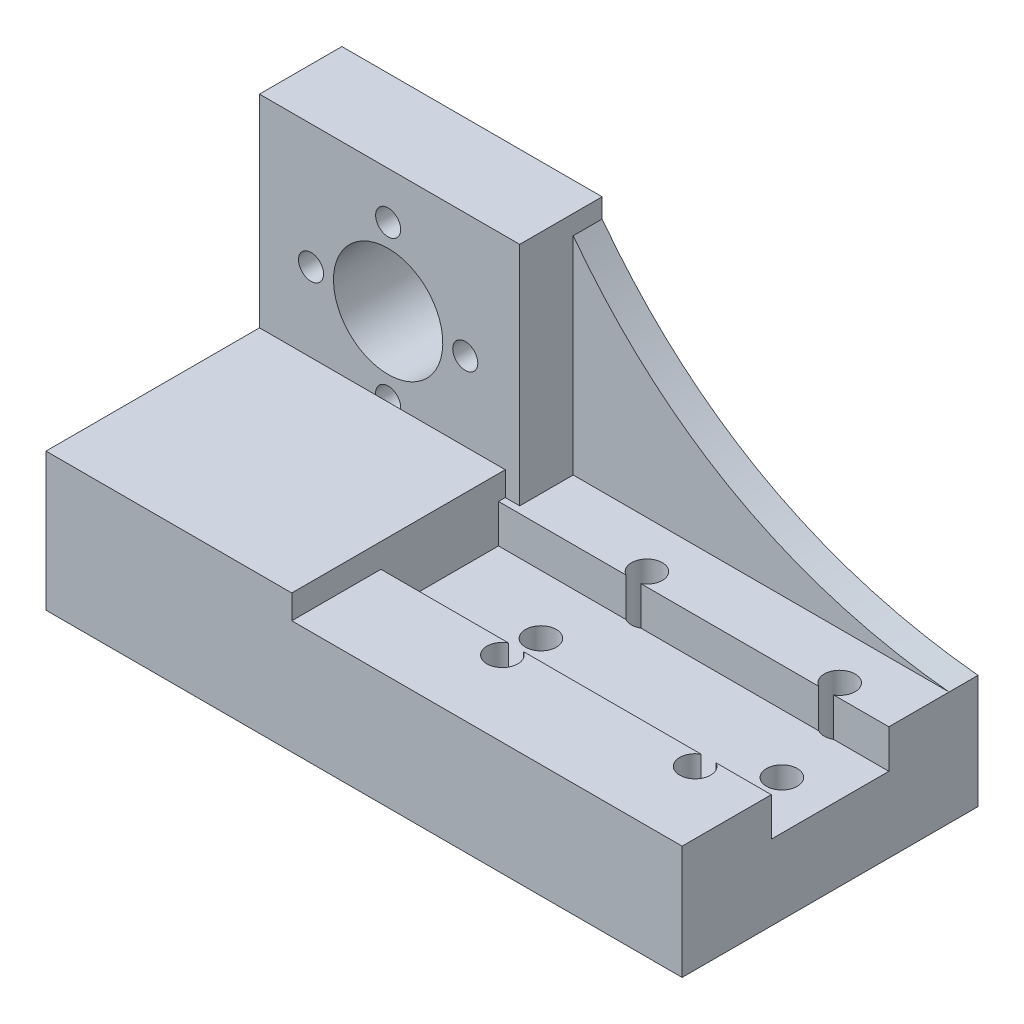
from build123d import *
from build123d.topology import SkipClean

# Parameters (mm, degrees)
CROQUIS2_R                         = 10.875
CROQUIS2_R_2                       = 5.67
CROQUIS2_R_3                       = 1.6
CROQUIS2_R_4                       = 1.3
SALIENTE_EXTRUIR1_DEPTH            = 30.7
CROQUIS4_W                         = 27
CROQUIS4_H                         = 26
CORTAR_EXTRUIR2_DEPTH              = 22.7
CROQUIS3_W                         = 12.3
CROQUIS3_H                         = 8
CORTAR_EXTRUIR5_DEPTH              = 45
CORTAR_EXTRUIR7_START              = -24.5
CROQUIS7_W                         = 48
CROQUIS7_H                         = 9.85
CORTAR_EXTRUIR7_DEPTH              = 24.5
CORTAR_EXTRUIR10_DEPTH             = 77.154202117
CORTAR_EXTRUIR10_DEPTH_BACK        = 77.154202117
CROQUIS11_R                        = 1.6
CROQUIS18_W                        = 48
CROQUIS18_H                        = 9.85
CORTAR_EXTRUIR12_DEPTH             = 8
CROQUIS19_W                        = 12.3
CROQUIS19_H                        = 8
CORTAR_EXTRUIR13_DEPTH             = 3
CROQUIS20_R                        = 1.3
CROQUIS20_R_2                      = 5.67
SALIENTE_EXTRUIR2_DEPTH            = 0.55
SALIENTE_EXTRUIR4_START            = -22.15
SALIENTE_EXTRUIR4_DEPTH            = 22.15
S_LIDO_MOVER_COPIAR1_START         = 8.55
S_LIDO_MOVER_COPIAR1_DEPTH         = 22.15
S_LIDO_MOVER_COPIAR1_2_DEPTH       = 22.15
S_LIDO_MOVER_COPIAR1_3_DEPTH       = 30.7
S_LIDO_MOVER_COPIAR1_4_OUTLINE_R   = 1.3
S_LIDO_MOVER_COPIAR1_4_OUTLINE_R_2 = 5.67
S_LIDO_MOVER_COPIAR1_4_DEPTH       = 8.55
S_LIDO_MOVER_COPIAR1_START_2       = -34.15
S_LIDO_MOVER_COPIAR1_5_OUTLINE_R   = 1.6
S_LIDO_MOVER_COPIAR1_5_OUTLINE_W   = 75
S_LIDO_MOVER_COPIAR1_5_OUTLINE_H   = 30.7
S_LIDO_MOVER_COPIAR1_5_DEPTH       = 52
CROQUIS23_R                        = 1.6
CORTAR_EXTRUIR17_DEPTH             = 144.777475635
CORTAR_EXTRUIR18_DEPTH             = 3
CORTAR_EXTRUIR18_DEPTH_BACK        = 144.777475635
CORTAR_EXTRUIR18_START             = -7.8
CROQUIS24_W                        = 75
CROQUIS24_H                        = 30.7
CORTAR_EXTRUIR19_DEPTH             = 11.7
CROQUIS28_W                        = 27
CROQUIS28_H                        = 8.55
CORTAR_EXTRUIR21_DEPTH             = 5
CORTAR_EXTRUIR22_START             = -8
CORTAR_EXTRUIR22_DEPTH             = 8
CROQUIS30_W                        = 1.5
CROQUIS30_H                        = 22.15
CORTAR_EXTRUIR23_DEPTH             = 6.5
CROQUIS31_W                        = 30.7
CROQUIS31_H                        = 7.8
CORTAR_EXTRUIR24_DEPTH             = 9
CROQUIS32_W                        = 40.5
CROQUIS32_H                        = 9.25
CROQUIS32_W_2                      = 39
SALIENTE_EXTRUIR5_DEPTH            = 4
CROQUIS33_W                        = 1.5
CROQUIS33_H                        = 0.7
SALIENTE_EXTRUIR6_DEPTH            = 4
CROQUIS34_R                        = 1.6
CORTAR_EXTRUIR25_DEPTH             = 143.013951779
SALIENTE_EXTRUIR7_DEPTH            = 3


with BuildPart() as part:
    # Croquis2 → Saliente-Extruir1 (new body)
    # profile 1 of 6: a face of its own
    with BuildSketch(Plane.XY):
        Polygon((-61.65, 17.85), (-61.65, -34.15), (-50.65, -34.15), (-50.65, -32.65), (-50.65, -22.65), (-50.65, -22.45), (-49.65, -22.45), (-22.65, -22.45), (-21.65, -22.45), (-21.65, -22.65), (-21.65, -32.65), (-21.65, -34.15), (13.35, -34.15), (13.35, 17.85), align=None)
        Circle(CROQUIS2_R, mode=Mode.SUBTRACT)
    # profile 2 of 6: a face of its own
    with BuildSketch(Plane.XY):
        Circle(CROQUIS2_R)
        with Locations(Location((0, 0, 0), (0, 0, 90))):
            Circle(CROQUIS2_R_2, mode=Mode.SUBTRACT)
        with Locations((0, -8)):
            Circle(CROQUIS2_R_3, mode=Mode.SUBTRACT)
        with Locations((-8, 0)):
            Circle(CROQUIS2_R_3, mode=Mode.SUBTRACT)
        with Locations((8, 0)):
            Circle(CROQUIS2_R_3, mode=Mode.SUBTRACT)
        with Locations((0, 8)):
            Circle(CROQUIS2_R_3, mode=Mode.SUBTRACT)
    # profile 3 of 6: a face of its own
    with BuildSketch(Plane.XY):
        with Locations((0, 8)):
            Circle(CROQUIS2_R_3)
        with Locations(Location((0, 8, 0), (0, 0, 90))):
            Circle(CROQUIS2_R_4, mode=Mode.SUBTRACT)
    # profile 4 of 6: a face of its own
    with BuildSketch(Plane.XY):
        with Locations((8, 0)):
            Circle(CROQUIS2_R_3)
        with Locations(Location((8, 0, 0), (0, 0, 90))):
            Circle(CROQUIS2_R_4, mode=Mode.SUBTRACT)
    # profile 5 of 6: a face of its own
    with BuildSketch(Plane.XY):
        with Locations((0, -8)):
            Circle(CROQUIS2_R_3)
        with Locations(Location((0, -8, 0), (0, 0, 90))):
            Circle(CROQUIS2_R_4, mode=Mode.SUBTRACT)
    # profile 6 of 6: a face of its own
    with BuildSketch(Plane.XY):
        with Locations((-8, 0)):
            Circle(CROQUIS2_R_3)
        with Locations(Location((-8, 0, 0), (0, 0, 90))):
            Circle(CROQUIS2_R_4, mode=Mode.SUBTRACT)
    extrude(amount=SALIENTE_EXTRUIR1_DEPTH)

    # Croquis4 → Cortar-Extruir2 (cut)
    with BuildSketch(Plane.XY.offset(30.7)):
        with Locations((-0.15, 4.85)):
            Rectangle(CROQUIS4_W, CROQUIS4_H)
    extrude(amount=-CORTAR_EXTRUIR2_DEPTH, mode=Mode.SUBTRACT)

    # Croquis3 → Cortar-Extruir5 (cut)
    with BuildSketch(Plane.ZY.offset(61.65)):
        with Locations((14.7, -10.65)):
            Rectangle(CROQUIS3_W, CROQUIS3_H)
    extrude(amount=-CORTAR_EXTRUIR5_DEPTH, mode=Mode.SUBTRACT)

    # Croquis7 → Cortar-Extruir7 (cut)
    with BuildSketch(Plane(origin=(0, 17.85, 0), x_dir=(1, 0, 0), z_dir=(0, 1, 0)).offset(CORTAR_EXTRUIR7_START)):
        with Locations((-37.65, -25.775)):
            Rectangle(CROQUIS7_W, CROQUIS7_H)
        Polygon((-61.65, -8.55), (-61.65, -20.85), (-13.65, -20.85), (-13.65, 0), (-61.65, 0), align=None)
    extrude(amount=CORTAR_EXTRUIR7_DEPTH, mode=Mode.SUBTRACT)

    # Croquis11 → Cortar-Extruir10 (cut, two sides: drawn at the far end of the back side and taken through both)
    with BuildSketch(Plane(origin=(0, -14.65, 0), x_dir=(1, 0, 0), z_dir=(0, 1, 0)).offset(-CORTAR_EXTRUIR10_DEPTH_BACK)):
        with BuildLine():
            Line((-44.711250543, -8.55), (-47.588749457, -8.55))
            ThreePointArc((-47.588749457, -8.55), (-46.15, -9.45), (-44.711250543, -8.55))
        make_face()
        with BuildLine():
            ThreePointArc((-44.55, -7.85), (-46.509166305, -6.290833695), (-47.588749457, -8.55))
            Line((-47.588749457, -8.55), (-44.711250543, -8.55))
            ThreePointArc((-44.711250543, -8.55), (-44.590833695, -8.209166305), (-44.55, -7.85))
        make_face()
        with BuildLine():
            Line((-24.711250543, -8.55), (-27.588749457, -8.55))
            ThreePointArc((-27.588749457, -8.55), (-26.15, -9.45), (-24.711250543, -8.55))
        make_face()
        with BuildLine():
            ThreePointArc((-24.55, -7.85), (-26.509166305, -6.290833695), (-27.588749457, -8.55))
            Line((-27.588749457, -8.55), (-24.711250543, -8.55))
            ThreePointArc((-24.711250543, -8.55), (-24.590833695, -8.209166305), (-24.55, -7.85))
        make_face()
        with Locations(Location((-26.15, -22.849986467, 0), (0, 0, 270))):
            Circle(CROQUIS11_R)
        with Locations(Location((-46.15, -22.849986467, 0), (0, 0, 270))):
            Circle(CROQUIS11_R)
    extrude(amount=CORTAR_EXTRUIR10_DEPTH + CORTAR_EXTRUIR10_DEPTH_BACK, mode=Mode.SUBTRACT)

    # Croquis18 → Cortar-Extruir12 (cut)
    with BuildSketch(Plane(origin=(0, -6.65, 0), x_dir=(1, 0, 0), z_dir=(0, 1, 0))):
        with Locations((-37.65, -25.775)):
            Rectangle(CROQUIS18_W, CROQUIS18_H)
    extrude(amount=-CORTAR_EXTRUIR12_DEPTH, mode=Mode.SUBTRACT)

    # Croquis19 → Cortar-Extruir13 (cut)
    with BuildSketch(Plane.ZY.offset(16.65)):
        with Locations((14.7, -10.65)):
            Rectangle(CROQUIS19_W, CROQUIS19_H)
    extrude(amount=-CORTAR_EXTRUIR13_DEPTH, mode=Mode.SUBTRACT)

    # Croquis20 → Saliente-Extruir2 (add)
    with SkipClean():  # the faces are left unmerged after this step: merging them gives an invalid solid
        with BuildSketch(Plane.XY.offset(8)):
            with BuildLine():
                ThreePointArc((-1.291317157, -8.15), (0, -6.7), (1.291317157, -8.15))
                Line((1.291317157, -8.15), (13.35, -8.15))
                Line((13.35, -8.15), (13.35, 17.85))
                Line((13.35, 17.85), (-13.65, 17.85))
                Line((-13.65, 17.85), (-13.65, -6.65))
                Line((-13.65, -6.65), (-13.65, -8.15))
                Line((-13.65, -8.15), (-1.291317157, -8.15))
            make_face()
            with Locations(Location((8, 0, 0), (0, 0, 90))):
                Circle(CROQUIS20_R, mode=Mode.SUBTRACT)
            with Locations(Location((0, 0, 0), (0, 0, 90))):
                Circle(CROQUIS20_R_2, mode=Mode.SUBTRACT)
            with Locations(Location((0, 8, 0), (0, 0, 90))):
                Circle(CROQUIS20_R, mode=Mode.SUBTRACT)
            with Locations(Location((-8, 0, 0), (0, 0, 90))):
                Circle(CROQUIS20_R, mode=Mode.SUBTRACT)
        extrude(amount=SALIENTE_EXTRUIR2_DEPTH)

    # Croquis22 → Saliente-Extruir4 (add)
    with BuildSketch(Plane.XY.offset(30.7).offset(SALIENTE_EXTRUIR4_START)):
        with BuildLine():
            Line((-1.291317157, -8.15), (1.291317157, -8.15))
            ThreePointArc((1.291317157, -8.15), (0, -9.3), (-1.291317157, -8.15))
        make_face()
    extrude(amount=SALIENTE_EXTRUIR4_DEPTH)

    # Sólido-Mover/Copiar1: read off the stored shape, not the designer's step
    # Sólido-Mover/Copiar1 outline → Sólido-Mover/Copiar1 (cut)
    with BuildSketch(Plane.XY.offset(S_LIDO_MOVER_COPIAR1_START)):
        with BuildLine():
            Line((1.291317157, -8.15), (-1.291317157, -8.15))
            ThreePointArc((-1.291317157, -8.15), (0, -9.3), (1.291317157, -8.15))
        make_face()
    extrude(amount=S_LIDO_MOVER_COPIAR1_DEPTH, mode=Mode.SUBTRACT)



with BuildPart() as body_2:
    # S_lido-Mover_Copiar1 2 outline → S_lido-Mover_Copiar1 2 (new body)
    with BuildSketch(Plane.XY.offset(S_LIDO_MOVER_COPIAR1_START)):
        with BuildLine():
            Line((-122.008682843, -8.15), (-124.591317157, -8.15))
            ThreePointArc((-124.591317157, -8.15), (-123.3, -9.3), (-122.008682843, -8.15))
        make_face()
    extrude(amount=S_LIDO_MOVER_COPIAR1_2_DEPTH)


with BuildPart() as part_1:
    add(part.part)

    add(body_2.part)  # S_lido-Mover_Copiar1 3 merges body 2
    # S_lido-Mover_Copiar1 3 outline → S_lido-Mover_Copiar1 3 (add)
    with BuildSketch(Plane.XY):
        with BuildLine():
            Line((-124.591317157, -8.15), (-136.65, -8.15))
            Line((-136.65, -8.15), (-136.65, -34.15))
            Line((-136.65, -34.15), (-101.65, -34.15))
            Line((-101.65, -34.15), (-101.65, -22.45))
            Line((-101.65, -22.45), (-72.65, -22.45))
            Line((-72.65, -22.45), (-72.65, -34.15))
            Line((-72.65, -34.15), (-50.65, -34.15))
            Line((-50.65, -34.15), (-50.65, -22.45))
            Line((-50.65, -22.45), (-21.65, -22.45))
            Line((-21.65, -22.45), (-21.65, -34.15))
            Line((-21.65, -34.15), (13.35, -34.15))
            Line((13.35, -34.15), (13.35, -8.15))
            Line((13.35, -8.15), (1.291317157, -8.15))
            ThreePointArc((1.291317157, -8.15), (0, -9.3), (-1.291317157, -8.15))
            Line((-1.291317157, -8.15), (-13.65, -8.15))
            Line((-13.65, -8.15), (-13.65, -14.65))
            Line((-13.65, -14.65), (-109.65, -14.65))
            Line((-109.65, -14.65), (-109.65, -8.15))
            Line((-109.65, -8.15), (-122.008682843, -8.15))
            ThreePointArc((-122.008682843, -8.15), (-123.3, -9.3), (-124.591317157, -8.15))
        make_face()
    extrude(amount=S_LIDO_MOVER_COPIAR1_3_DEPTH)

    # S_lido-Mover_Copiar1 4 outline → S_lido-Mover_Copiar1 4 (add)
    with BuildSketch(Plane.XY):
        with BuildLine():
            Line((-136.65, 17.85), (-136.65, -8.15))
            Line((-136.65, -8.15), (-124.591317157, -8.15))
            ThreePointArc((-124.591317157, -8.15), (-123.3, -6.7), (-122.008682843, -8.15))
            Line((-122.008682843, -8.15), (-109.65, -8.15))
            Line((-109.65, -8.15), (-109.65, -14.65))
            Line((-109.65, -14.65), (-13.65, -14.65))
            Line((-13.65, -14.65), (-13.65, -8.15))
            Line((-13.65, -8.15), (-1.291317157, -8.15))
            ThreePointArc((-1.291317157, -8.15), (0, -6.7), (1.291317157, -8.15))
            Line((1.291317157, -8.15), (13.35, -8.15))
            Line((13.35, -8.15), (13.35, 17.85))
            Line((13.35, 17.85), (-13.65, 17.85))
            Line((-13.65, 17.85), (-13.65, -6.65))
            Line((-13.65, -6.65), (-109.65, -6.65))
            Line((-109.65, -6.65), (-109.65, 17.85))
            Line((-109.65, 17.85), (-136.65, 17.85))
        make_face()
        with Locations((-131.3, 0)):
            Circle(S_LIDO_MOVER_COPIAR1_4_OUTLINE_R, mode=Mode.SUBTRACT)
        with Locations((-123.3, 0)):
            Circle(S_LIDO_MOVER_COPIAR1_4_OUTLINE_R_2, mode=Mode.SUBTRACT)
        with Locations((-115.3, 0)):
            Circle(S_LIDO_MOVER_COPIAR1_4_OUTLINE_R, mode=Mode.SUBTRACT)
        with Locations((-123.3, 8)):
            Circle(S_LIDO_MOVER_COPIAR1_4_OUTLINE_R, mode=Mode.SUBTRACT)
        with Locations((-8, 0)):
            Circle(S_LIDO_MOVER_COPIAR1_4_OUTLINE_R, mode=Mode.SUBTRACT)
        Circle(S_LIDO_MOVER_COPIAR1_4_OUTLINE_R_2, mode=Mode.SUBTRACT)
        with Locations((8, 0)):
            Circle(S_LIDO_MOVER_COPIAR1_4_OUTLINE_R, mode=Mode.SUBTRACT)
        with Locations((0, 8)):
            Circle(S_LIDO_MOVER_COPIAR1_4_OUTLINE_R, mode=Mode.SUBTRACT)
    extrude(amount=S_LIDO_MOVER_COPIAR1_4_DEPTH)

    # S_lido-Mover_Copiar1 5 outline → S_lido-Mover_Copiar1 5 (cut)
    with BuildSketch(Plane(origin=(0, 0, 0), x_dir=(1, 0, 0), z_dir=(0, 1, 0)).offset(S_LIDO_MOVER_COPIAR1_START_2)):
        with Locations((-97.15, -7.85)):
            Circle(S_LIDO_MOVER_COPIAR1_5_OUTLINE_R)
        with Locations((-77.15, -7.85)):
            Circle(S_LIDO_MOVER_COPIAR1_5_OUTLINE_R)
        with Locations((-24.15, -15.35)):
            Rectangle(S_LIDO_MOVER_COPIAR1_5_OUTLINE_W, S_LIDO_MOVER_COPIAR1_5_OUTLINE_H)
        with Locations((-97.15, -22.849986467)):
            Circle(S_LIDO_MOVER_COPIAR1_5_OUTLINE_R)
        with Locations((-77.15, -22.849986467)):
            Circle(S_LIDO_MOVER_COPIAR1_5_OUTLINE_R)
    extrude(amount=S_LIDO_MOVER_COPIAR1_5_DEPTH, mode=Mode.SUBTRACT)

    # Croquis23 → Cortar-Extruir17 (cut, through all)
    with BuildSketch(Plane(origin=(0, -14.65, 0), x_dir=(1, 0, 0), z_dir=(0, 1, 0))):
        with Locations(Location((-100.65, -15.35, 0), (0, 0, 270))):
            Circle(CROQUIS23_R)
        with Locations(Location((-75.65, -15.35, 0), (0, 0, 270))):
            Circle(CROQUIS23_R)
    extrude(amount=-CORTAR_EXTRUIR17_DEPTH, mode=Mode.SUBTRACT)

    # Croquis23<3> → Cortar-Extruir18 (cut, two sides: drawn at the far end of the back side and taken through both)
    with BuildSketch(Plane(origin=(0, -14.65, 0), x_dir=(1, 0, 0), z_dir=(0, 1, 0)).offset(CORTAR_EXTRUIR18_START - CORTAR_EXTRUIR18_DEPTH_BACK)):
        Polygon((-73.917949192, -12.35), (-77.382050808, -12.35), (-79.114101615, -15.35), (-77.382050808, -18.35), (-73.917949192, -18.35), (-72.185898385, -15.35), align=None)
        Polygon((-98.917949192, -12.35), (-102.382050808, -12.35), (-104.114101615, -15.35), (-102.382050808, -18.35), (-98.917949192, -18.35), (-97.185898385, -15.35), align=None)
    extrude(amount=CORTAR_EXTRUIR18_DEPTH + CORTAR_EXTRUIR18_DEPTH_BACK, mode=Mode.SUBTRACT)

    # Croquis24 → Cortar-Extruir19 (cut)
    with BuildSketch(Plane.XZ.offset(34.15)):
        with Locations((-99.15, 15.35)):
            Rectangle(CROQUIS24_W, CROQUIS24_H)
    extrude(amount=-CORTAR_EXTRUIR19_DEPTH, mode=Mode.SUBTRACT)

    # Croquis28 → Cortar-Extruir21 (cut)
    with BuildSketch(Plane(origin=(0, 17.85, 0), x_dir=(1, 0, 0), z_dir=(0, 1, 0))):
        with Locations((-123.15, -4.275)):
            Rectangle(CROQUIS28_W, CROQUIS28_H)
    extrude(amount=-CORTAR_EXTRUIR21_DEPTH, mode=Mode.SUBTRACT)

    # Croquis29 → Cortar-Extruir22 (cut)
    with BuildSketch(Plane(origin=(0, -6.65, 0), x_dir=(1, 0, 0), z_dir=(0, 1, 0)).offset(CORTAR_EXTRUIR22_START)):
        with BuildLine():
            Line((-109.65, -8.55), (-98.588749457, -8.55))
            ThreePointArc((-98.588749457, -8.55), (-97.15, -6.25), (-95.711250543, -8.55))
            Line((-95.711250543, -8.55), (-78.588749457, -8.55))
            ThreePointArc((-78.588749457, -8.55), (-77.15, -6.25), (-75.711250543, -8.55))
            Line((-75.711250543, -8.55), (-61.65, -8.55))
            Line((-61.65, -8.55), (-61.65, 0))
            Line((-61.65, 0), (-109.65, 0))
            Line((-109.65, 0), (-109.65, -8.55))
        make_face()
    extrude(amount=CORTAR_EXTRUIR22_DEPTH, mode=Mode.SUBTRACT)

    # Croquis30 → Cortar-Extruir23 (cut)
    with BuildSketch(Plane(origin=(0, -8.15, 0), x_dir=(1, 0, 0), z_dir=(0, 1, 0))):
        with Locations((-110.4, -19.625)):
            Rectangle(CROQUIS30_W, CROQUIS30_H)
    extrude(amount=-CORTAR_EXTRUIR23_DEPTH, mode=Mode.SUBTRACT)

    # Croquis31 → Cortar-Extruir24 (cut)
    with BuildSketch(Plane(origin=(-61.65, 0, 0), x_dir=(0, 0, -1), z_dir=(1, 0, 0))):
        with Locations((-15.35, -18.55)):
            Rectangle(CROQUIS31_W, CROQUIS31_H)
    extrude(amount=-CORTAR_EXTRUIR24_DEPTH, mode=Mode.SUBTRACT)

    # Croquis32 → Saliente-Extruir5 (add)
    with BuildSketch(Plane(origin=(0, -14.65, 0), x_dir=(1, 0, 0), z_dir=(0, 1, 0))):
        with Locations((-90.9, -26.075)):
            Rectangle(CROQUIS32_W, CROQUIS32_H)
        with Locations((-90.15, -4.625)):
            Rectangle(CROQUIS32_W_2, CROQUIS32_H)
    extrude(amount=SALIENTE_EXTRUIR5_DEPTH)

    # Croquis33 → Saliente-Extruir6 (add)
    with BuildSketch(Plane(origin=(0, -14.65, 0), x_dir=(1, 0, 0), z_dir=(0, 1, 0))):
        with Locations((-110.4, -8.9)):
            Rectangle(CROQUIS33_W, CROQUIS33_H)
    extrude(amount=SALIENTE_EXTRUIR6_DEPTH)

    # Croquis34 → Cortar-Extruir25 (cut, through all)
    with BuildSketch(Plane(origin=(0, -10.65, 0), x_dir=(1, 0, 0), z_dir=(0, 1, 0))):
        with Locations(Location((-97.15, -22.849986467, 0), (0, 0, 270))):
            Circle(CROQUIS34_R)
        with Locations(Location((-77.15, -22.849986467, 0), (0, 0, 270))):
            Circle(CROQUIS34_R)
        with Locations(Location((-77.15, -7.85, 0), (0, 0, 270))):
            Circle(CROQUIS34_R)
        with Locations(Location((-97.15, -7.85, 0), (0, 0, 270))):
            Circle(CROQUIS34_R)
    extrude(amount=-CORTAR_EXTRUIR25_DEPTH, mode=Mode.SUBTRACT)

    # Croquis36 → Saliente-Extruir7 (add)
    with BuildSketch(Plane(origin=(0, 0, 0), x_dir=(-1, 0, 0), z_dir=(0, 0, -1))):
        with BuildLine():
            Line((70.65, -10.65), (109.65, -10.65))
            Line((109.65, -10.65), (109.65, 10.85))
            add(Edge.make_bspline(
                [(109.65, 10.85), (95.352699805, -8.157116541), (70.65, -10.65)],
                knots=[0, 0, 0, 1, 1, 1], degree=2))
        make_face()
    extrude(amount=-SALIENTE_EXTRUIR7_DEPTH)


solid = part_1.part
